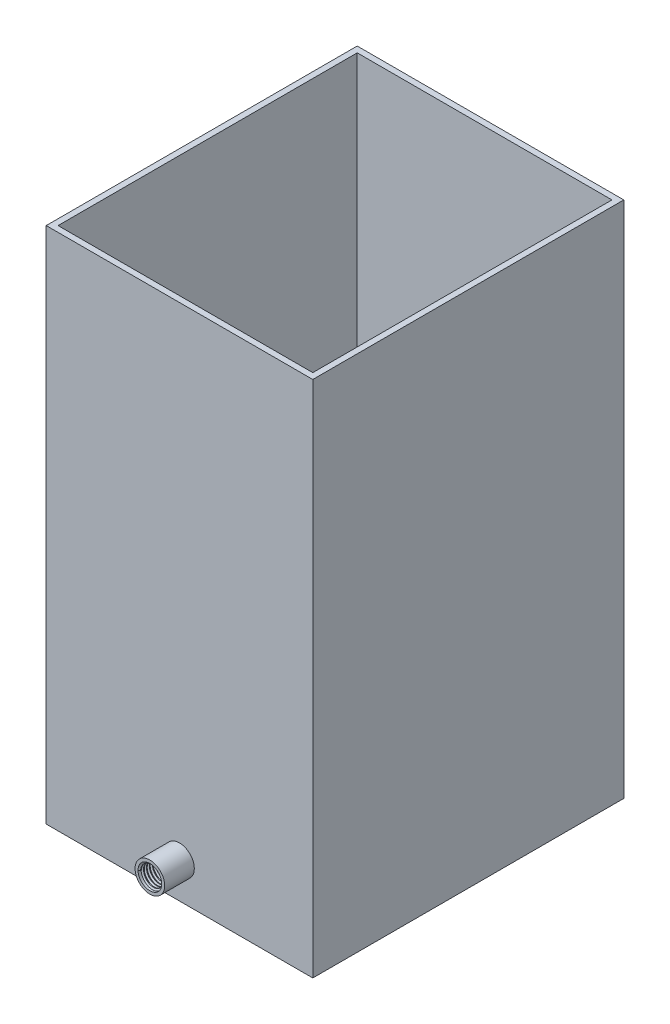
from build123d import *

# Parameters (mm, degrees)
SKETCH1_W           = 90
SKETCH1_H           = 175
BOSS_EXTRUDE1_DEPTH = 105
SHELL1_T            = -2
SKETCH2_R           = 5
SKETCH2_R_2         = 4
BOSS_EXTRUDE2_DEPTH = 10
CUT_EXTRUDE1_REACH  = 210.986
SKETCH3_R           = 4
THREAD1_PITCH       = 1
SKETCH4_W           = 20
SKETCH4_H           = 8
BOSS_EXTRUDE3_DEPTH = 3


with BuildPart() as part:
    # Sketch1 → Boss-Extrude1 (new body)
    with BuildSketch(Plane.XY):
        with Locations((0, 87.5)):
            Rectangle(SKETCH1_W, SKETCH1_H)
    extrude(amount=BOSS_EXTRUDE1_DEPTH)

    # Shell1
    shell1_openings = [part.faces().sort_by_distance(p)[0] for p in [
        (0, 175, 52.5),
    ]]
    offset(amount=SHELL1_T, openings=shell1_openings, kind=Kind.INTERSECTION)

    # Sketch2 → Boss-Extrude2 (add)
    with BuildSketch(Plane.XY.offset(105)):
        with Locations((0, 12)):
            Circle(SKETCH2_R)
        with Locations((0, 12)):
            Circle(SKETCH2_R_2, mode=Mode.SUBTRACT)
    extrude(amount=BOSS_EXTRUDE2_DEPTH)

    # Sketch3 → Cut-Extrude1 (cut, up to next)
    with BuildSketch(Plane.XY.offset(105), mode=Mode.PRIVATE) as cut_extrude1_sk1:
        with Locations((0, 12)):
            Circle(SKETCH3_R)
    cut_extrude1_tool1 = extrude(cut_extrude1_sk1.sketch, amount=-CUT_EXTRUDE1_REACH, mode=Mode.PRIVATE) & part.part
    add(cut_extrude1_tool1.solids().sort_by_distance((0, 12, 105))[0], mode=Mode.SUBTRACT)

    # Thread1: the profile of Thread Profile1 profile screwed along a right-hand helix of 12 turns, 8 arcs to a turn; built about Z, then put on its axis
    thread1_z = Axis((0, 0, 0), (0, 0, 1))
    thread1_corners = [(4.0003, 0, -0.000173205), (4.0003, 0, 0.875173202), (3.458734125, 0, 0.562499999), (3.458734125, 0, 0.312499999)]
    with BuildLine(mode=Mode.PRIVATE) as thread1_profile:
        Line(thread1_corners[0], thread1_corners[1])
        Line(thread1_corners[1], thread1_corners[2])
        Line(thread1_corners[2], thread1_corners[3])
        Line(thread1_corners[3], thread1_corners[0])
    thread1_cap = Face(thread1_profile.wire())
    thread1_turn_angles = [0, 22.5, 45, 67.5, 90, 112.5, 135, 157.5, 180, 202.5, 225, 247.5, 270, 292.5, 315, 337.5, 360]
    thread1_turn_weights = [1, 0.9238795325112867, 1, 0.9238795325112867, 1, 0.9238795325112867, 1, 0.9238795325112867, 1, 0.9238795325112867, 1, 0.9238795325112867, 1, 0.9238795325112867, 1, 0.9238795325112867, 1]
    thread1_turn_rails = [Edge.make_bspline([Vector(p[0], p[1], 0).rotate(thread1_z, thread1_turn_angles[k]) / thread1_turn_weights[k] + Vector(0, 0, p[2] + THREAD1_PITCH * thread1_turn_angles[k] / 360) for k in range(17)], [0, 0, 0, 1, 1, 2, 2, 3, 3, 4, 4, 5, 5, 6, 6, 7, 7, 8, 8, 8], 2, thread1_turn_weights) for p in thread1_corners]
    thread1_turn_sides = [Face.make_surface_from_curves(thread1_turn_rails[p[0]], thread1_turn_rails[p[1]]) for p in [(0, 1), (1, 2), (2, 3), (3, 0)]]
    thread1 = Plane(origin=(0, 12, 115), x_dir=(-1, 0, 0), z_dir=(0, 0, -1)) * Solid(Shell([*[p.moved(Location((0, 0, THREAD1_PITCH * i))) for i in range(12) for p in thread1_turn_sides], thread1_cap, thread1_cap.rotate(thread1_z, 4320).moved(Location((0, 0, THREAD1_PITCH * 4320 / 360)))]))
    add(thread1)

    # Sketch4 → Boss-Extrude3 (add)
    with BuildSketch(Plane.XZ):
        with Locations((0, 61)):
            Rectangle(SKETCH4_W, SKETCH4_H)
    extrude(amount=BOSS_EXTRUDE3_DEPTH)


solid = part.part
